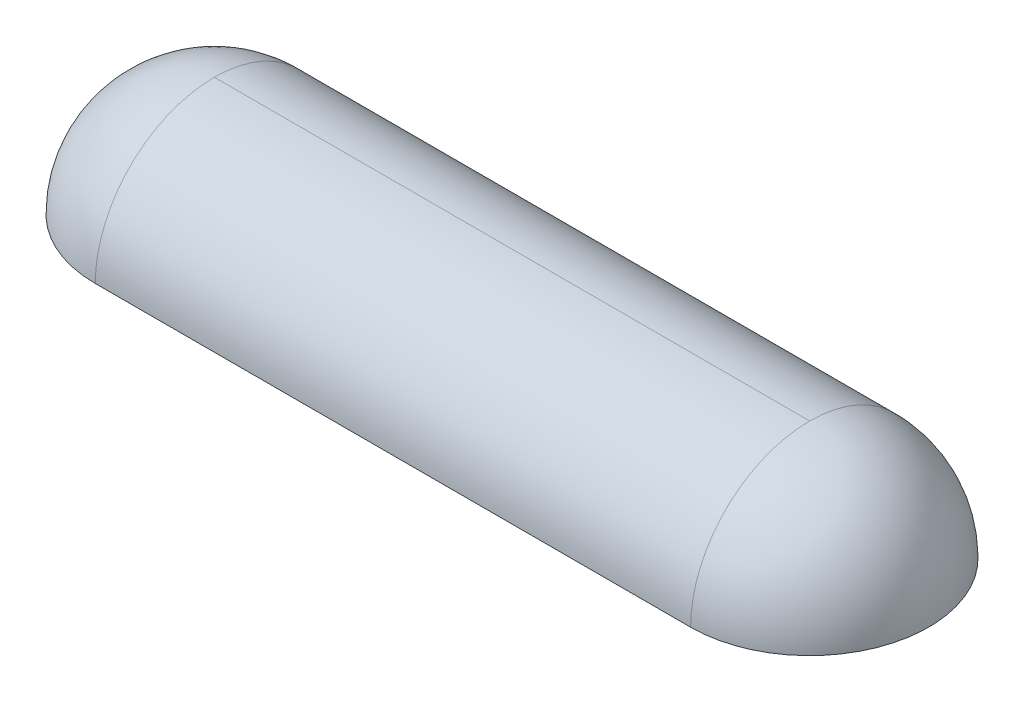
from build123d import *

# Parameters (mm, degrees)
BOSS_EXTRUDE1_DEPTH = 10
FILLET1_R           = 10


# Read off the part's stored shape, not the designer's step: Shell1
with BuildPart() as part:
    # Sketch1 → Boss-Extrude1 (new body)
    with BuildSketch(Plane(origin=(0, 0, 0), x_dir=(1, 0, 0), z_dir=(0, 1, 0))):
        with BuildLine():
            Line((-25, 10), (25, 10))
            ThreePointArc((25, 10), (35, 0), (25, -10))
            Line((25, -10), (-25, -10))
            ThreePointArc((-25, -10), (-35, 0), (-25, 10))
        make_face()
    extrude(amount=BOSS_EXTRUDE1_DEPTH)

    # Fillet1
    fillet1_edges = [part.edges().sort_by_distance(p)[0] for p in [
        (-35, 10, 0),
        (0, 10, -10),
        (35, 10, 0),
        (0, 10, 10),
    ]]
    fillet(fillet1_edges, radius=FILLET1_R - 0.0001)  # a hair under: the kernel refuses the full size

    # Shell1 outline → Shell1 (revolve, cut)
    with BuildSketch(Plane.YX):
        with BuildLine():
            Line((9.5, -25), (9.5, 25))
            ThreePointArc((9.5, 25), (6.717514421, 31.717514421), (0, 34.5))
            Line((0, 34.5), (0, -34.5))
            ThreePointArc((0, -34.5), (6.717514421, -31.717514421), (9.5, -25))
        make_face()
    revolve(axis=Axis((0, 0, 0), (1, 0, 0)), mode=Mode.SUBTRACT)


solid = part.part
